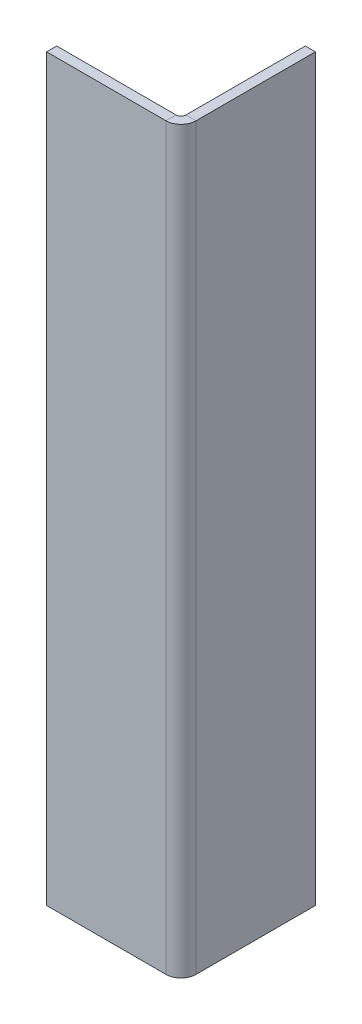
from build123d import *

# Parameters (mm, degrees)
BASE_FLANGE1_DEPTH = 110


# Sheet-metal steps are written as plain solids
with BuildPart() as part:
    # Sketch1 → Base-Flange1 (new body)
    with BuildSketch(Plane(origin=(0, 0, 0), x_dir=(1, 0, 0), z_dir=(0, 1, 0))):
        with BuildLine():
            Line((0, 0), (0, -17.7634))
            ThreePointArc((0, -17.7634), (-0.655084973, -19.344915027), (-2.2366, -20))
            Line((-2.2366, -20), (-20, -20))
            Line((-20, -20), (-20, -18.5))
            Line((-20, -18.5), (-2.2366, -18.5))
            ThreePointArc((-2.2366, -18.5), (-1.715745145, -18.284254855), (-1.5, -17.7634))
            Line((-1.5, -17.7634), (-1.5, 0))
            Line((-1.5, 0), (0, 0))
        make_face()
    extrude(amount=BASE_FLANGE1_DEPTH)


solid = part.part
